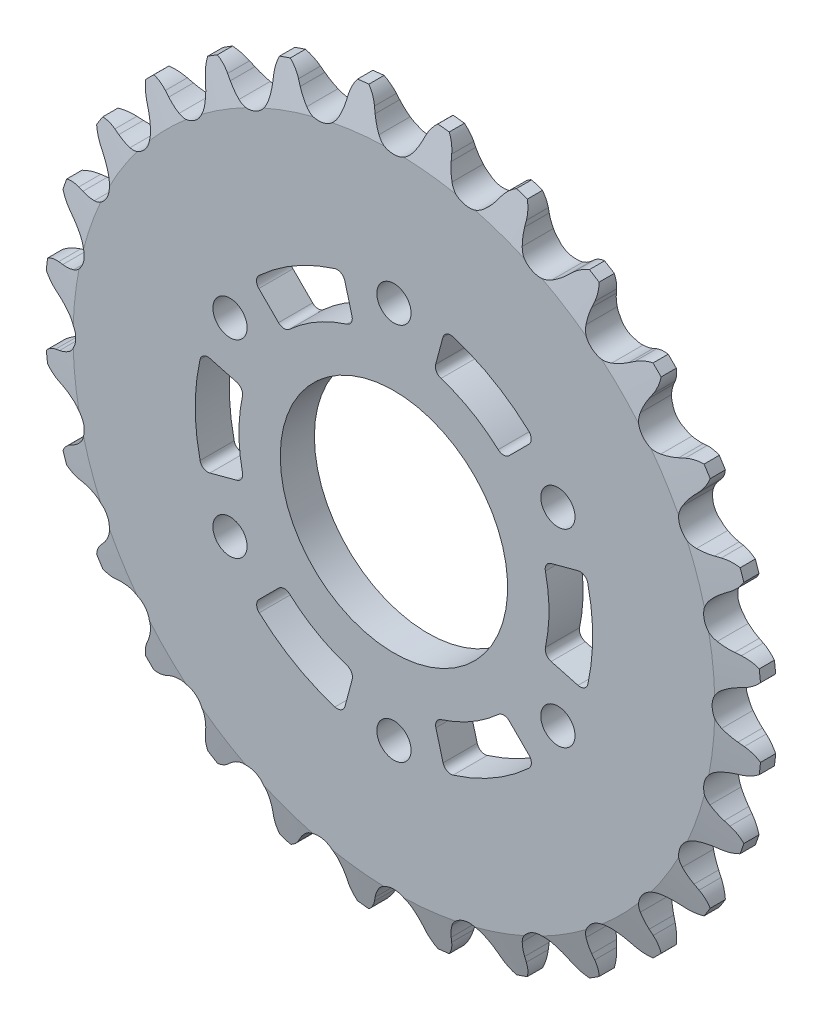
from build123d import *

# Parameters (mm, degrees)
CUT_EXTRUDE1_START    = -4.2926
CUT_EXTRUDE1_DEPTH    = 4.2926
CUT_EXTRUDE2_DEPTH    = 64.666804555
CUT_EXTRUDE3_DEPTH    = 64.666804555
CUT_EXTRUDE4_DEPTH    = 64.666804555
CUT_EXTRUDE5_DEPTH    = 64.666804555
CUT_EXTRUDE6_DEPTH    = 64.666804555
M25_CLEARANCE_HOLE1_D = 28.6
M4_CLEARANCE_HOLE1_D  = 4.3053
FILLET1_R             = 1


with BuildPart() as part:
    # Cut-Extrude1: read off the stored shape, not the designer's step
    # Cut-Extrude1 outline → Cut-Extrude1 (new body)
    with BuildSketch(Plane.XY.offset(2.146299997).offset(CUT_EXTRUDE1_START)):
        with BuildLine():
            ThreePointArc((39.558972766, 11.147399034), (40.203915636, 11.815256835), (40.935529884, 12.386856293))
            Line((40.935529884, 12.386856293), (41.504455801, 12.770601445))
            ThreePointArc((41.504455801, 12.770601445), (42.252526822, 13.418109876), (42.825156847, 14.224938406))
            ThreePointArc((42.825156847, 14.224938406), (42.593543808, 14.904125519), (42.351159936, 15.579543755))
            ThreePointArc((42.351159936, 15.579543755), (41.400410927, 15.853318653), (40.411831086, 15.89314666))
            Line((40.411831086, 15.89314666), (39.727762797, 15.838451055))
            ThreePointArc((39.727762797, 15.838451055), (38.799378208, 15.82919168), (37.878739938, 15.94922858))
            ThreePointArc((37.878739938, 15.94922858), (36.057866822, 17.36455347), (36.086617083, 19.670610032))
            ThreePointArc((36.086617083, 19.670610032), (36.566777547, 20.465236534), (37.152855853, 21.185304286))
            Line((37.152855853, 21.185304286), (37.62212628, 21.686026073))
            ThreePointArc((37.62212628, 21.686026073), (38.207357418, 22.483761578), (38.586094174, 23.3977834))
            ThreePointArc((38.586094174, 23.3977834), (38.209154806, 24.008403124), (37.822553308, 24.612951729))
            ThreePointArc((37.822553308, 24.612951729), (36.834720916, 24.668300961), (35.86206427, 24.487150687))
            Line((35.86206427, 24.487150687), (35.207317918, 24.281606901))
            ThreePointArc((35.207317918, 24.281606901), (34.304270273, 24.065994672), (33.380003604, 23.978160708))
            ThreePointArc((33.380003604, 23.978160708), (31.289844163, 24.952818062), (30.804727735, 27.207454507))
            ThreePointArc((30.804727735, 27.207454507), (31.096028541, 28.089003818), (31.507182493, 28.92143266))
            Line((31.507182493, 28.92143266), (31.85326625, 29.5140228))
            ThreePointArc((31.85326625, 29.5140228), (32.246311572, 30.42198359), (32.412163617, 31.397365833))
            ThreePointArc((32.412163617, 31.397365833), (31.908799236, 31.908799146), (31.397365924, 32.412163529))
            ThreePointArc((31.397365924, 32.412163529), (30.42198419, 32.246311653), (29.514023805, 31.85326673))
            Line((29.514023805, 31.85326673), (28.921431106, 31.507181585))
            ThreePointArc((28.921431106, 31.507181585), (28.089002986, 31.0960282), (27.207454507, 30.804727735))
            ThreePointArc((27.207454507, 30.804727735), (24.952818062, 31.289844163), (23.978160708, 33.380003604))
            ThreePointArc((23.978160708, 33.380003604), (24.06599482, 34.304271161), (24.28160744, 35.207319635))
            Line((24.28160744, 35.207319635), (24.487150443, 35.862063184))
            ThreePointArc((24.487150443, 35.862063184), (24.668301016, 36.834720313), (24.612951836, 37.822553239))
            ThreePointArc((24.612951836, 37.822553239), (24.008403232, 38.209154739), (23.397783508, 38.586094108))
            ThreePointArc((23.397783508, 38.586094108), (22.483762145, 38.207357631), (21.686026946, 37.622126971))
            Line((21.686026946, 37.622126971), (21.185302973, 37.152854623))
            ThreePointArc((21.185302973, 37.152854623), (20.465235799, 36.566777029), (19.670610032, 36.086617083))
            ThreePointArc((19.670610032, 36.086617083), (17.36455347, 36.057866822), (15.94922858, 37.878739938))
            ThreePointArc((15.94922858, 37.878739938), (15.829191627, 38.799379106), (15.838451198, 39.727764591))
            Line((15.838451198, 39.727764591), (15.893146664, 40.411829973))
            ThreePointArc((15.893146664, 40.411829973), (15.85331884, 41.400410352), (15.579543875, 42.351159893))
            ThreePointArc((15.579543875, 42.351159893), (14.90412564, 42.593543766), (14.224938527, 42.825156806))
            ThreePointArc((14.224938527, 42.825156806), (13.418110382, 42.252527156), (12.770602143, 41.504456669))
            Line((12.770602143, 41.504456669), (12.386855286, 40.935528393))
            ThreePointArc((12.386855286, 40.935528393), (11.815256233, 40.203914967), (11.147399034, 39.558972766))
            ThreePointArc((11.147399034, 39.558972766), (8.905557659, 39.017797475), (7.120535532, 40.478078083))
            ThreePointArc((7.120535532, 40.478078083), (6.798646668, 41.34892417), (6.601088878, 42.256093541))
            Line((6.601088878, 42.256093541), (6.502194146, 42.935178862))
            ThreePointArc((6.502194146, 42.935178862), (6.24338506, 43.890110942), (5.764912529, 44.756102546))
            ThreePointArc((5.764912529, 44.756102546), (5.052492953, 44.842114653), (4.338795729, 44.916787321))
            ThreePointArc((4.338795729, 44.916787321), (3.679618535, 44.178978539), (3.214806023, 43.305579603))
            Line((3.214806023, 43.305579603), (2.967278953, 42.665523837))
            ThreePointArc((2.967278953, 42.665523837), (2.572810384, 41.825060733), (2.0652109, 41.047676371))
            ThreePointArc((2.0652109, 41.047676371), (0, 40.021212838), (-2.0652109, 41.047676371))
            ThreePointArc((-2.0652109, 41.047676371), (-2.572810822, 41.825061518), (-2.967279602, 42.665525515))
            Line((-2.967279602, 42.665525515), (-3.214805536, 43.305578601))
            ThreePointArc((-3.214805536, 43.305578601), (-3.679618117, 44.178978101), (-4.338795603, 44.916787333))
            ThreePointArc((-4.338795603, 44.916787333), (-5.052492827, 44.842114667), (-5.764912403, 44.756102562))
            ThreePointArc((-5.764912403, 44.756102562), (-6.24338475, 43.890111462), (-6.502193895, 42.935179947))
            Line((-6.502193895, 42.935179947), (-6.601089137, 42.25609176))
            ThreePointArc((-6.601089137, 42.25609176), (-6.798646921, 41.348923306), (-7.120535532, 40.478078083))
            ThreePointArc((-7.120535532, 40.478078083), (-8.905557659, 39.017797475), (-11.147399034, 39.558972766))
            ThreePointArc((-11.147399034, 39.558972766), (-11.815256835, 40.203915636), (-12.386856293, 40.935529884))
            Line((-12.386856293, 40.935529884), (-12.770601445, 41.504455801))
            ThreePointArc((-12.770601445, 41.504455801), (-13.418109876, 42.252526822), (-14.224938406, 42.825156847))
            ThreePointArc((-14.224938406, 42.825156847), (-14.904125519, 42.593543808), (-15.579543755, 42.351159936))
            ThreePointArc((-15.579543755, 42.351159936), (-15.853318653, 41.400410927), (-15.89314666, 40.411831086))
            Line((-15.89314666, 40.411831086), (-15.838451055, 39.727762797))
            ThreePointArc((-15.838451055, 39.727762797), (-15.82919168, 38.799378208), (-15.94922858, 37.878739938))
            ThreePointArc((-15.94922858, 37.878739938), (-17.36455347, 36.057866822), (-19.670610032, 36.086617083))
            ThreePointArc((-19.670610032, 36.086617083), (-20.465236534, 36.566777547), (-21.185304286, 37.152855853))
            Line((-21.185304286, 37.152855853), (-21.686026073, 37.62212628))
            ThreePointArc((-21.686026073, 37.62212628), (-22.483761578, 38.207357418), (-23.3977834, 38.586094174))
            ThreePointArc((-23.3977834, 38.586094174), (-24.008403124, 38.209154806), (-24.612951729, 37.822553308))
            ThreePointArc((-24.612951729, 37.822553308), (-24.668300961, 36.834720916), (-24.487150687, 35.86206427))
            Line((-24.487150687, 35.86206427), (-24.281606901, 35.207317918))
            ThreePointArc((-24.281606901, 35.207317918), (-24.065994672, 34.304270273), (-23.978160708, 33.380003604))
            ThreePointArc((-23.978160708, 33.380003604), (-24.952818062, 31.289844163), (-27.207454507, 30.804727735))
            ThreePointArc((-27.207454507, 30.804727735), (-28.089003818, 31.096028541), (-28.92143266, 31.507182493))
            Line((-28.92143266, 31.507182493), (-29.5140228, 31.85326625))
            ThreePointArc((-29.5140228, 31.85326625), (-30.42198359, 32.246311572), (-31.397365833, 32.412163617))
            ThreePointArc((-31.397365833, 32.412163617), (-31.908799146, 31.908799236), (-32.412163529, 31.397365924))
            ThreePointArc((-32.412163529, 31.397365924), (-32.246311653, 30.42198419), (-31.85326673, 29.514023805))
            Line((-31.85326673, 29.514023805), (-31.507181585, 28.921431106))
            ThreePointArc((-31.507181585, 28.921431106), (-31.0960282, 28.089002986), (-30.804727735, 27.207454507))
            ThreePointArc((-30.804727735, 27.207454507), (-31.289844163, 24.952818062), (-33.380003604, 23.978160708))
            ThreePointArc((-33.380003604, 23.978160708), (-34.304271161, 24.06599482), (-35.207319635, 24.28160744))
            Line((-35.207319635, 24.28160744), (-35.862063184, 24.487150443))
            ThreePointArc((-35.862063184, 24.487150443), (-36.834720313, 24.668301016), (-37.822553239, 24.612951836))
            ThreePointArc((-37.822553239, 24.612951836), (-38.209154739, 24.008403232), (-38.586094108, 23.397783508))
            ThreePointArc((-38.586094108, 23.397783508), (-38.207357631, 22.483762145), (-37.622126971, 21.686026946))
            Line((-37.622126971, 21.686026946), (-37.152854623, 21.185302973))
            ThreePointArc((-37.152854623, 21.185302973), (-36.566777029, 20.465235799), (-36.086617083, 19.670610032))
            ThreePointArc((-36.086617083, 19.670610032), (-36.057866822, 17.36455347), (-37.878739938, 15.94922858))
            ThreePointArc((-37.878739938, 15.94922858), (-38.799379106, 15.829191627), (-39.727764591, 15.838451198))
            Line((-39.727764591, 15.838451198), (-40.411829973, 15.893146664))
            ThreePointArc((-40.411829973, 15.893146664), (-41.400410352, 15.85331884), (-42.351159893, 15.579543875))
            ThreePointArc((-42.351159893, 15.579543875), (-42.593543766, 14.90412564), (-42.825156806, 14.224938527))
            ThreePointArc((-42.825156806, 14.224938527), (-42.252527156, 13.418110382), (-41.504456669, 12.770602143))
            Line((-41.504456669, 12.770602143), (-40.935528393, 12.386855286))
            ThreePointArc((-40.935528393, 12.386855286), (-40.203914967, 11.815256233), (-39.558972766, 11.147399034))
            ThreePointArc((-39.558972766, 11.147399034), (-39.017797475, 8.905557659), (-40.478078083, 7.120535532))
            ThreePointArc((-40.478078083, 7.120535532), (-41.34892417, 6.798646668), (-42.256093541, 6.601088878))
            Line((-42.256093541, 6.601088878), (-42.935178862, 6.502194146))
            ThreePointArc((-42.935178862, 6.502194146), (-43.890110942, 6.24338506), (-44.756102546, 5.764912529))
            ThreePointArc((-44.756102546, 5.764912529), (-44.842114653, 5.052492953), (-44.916787321, 4.338795729))
            ThreePointArc((-44.916787321, 4.338795729), (-44.178978539, 3.679618535), (-43.305579603, 3.214806023))
            Line((-43.305579603, 3.214806023), (-42.665523837, 2.967278953))
            ThreePointArc((-42.665523837, 2.967278953), (-41.825060733, 2.572810384), (-41.047676371, 2.0652109))
            ThreePointArc((-41.047676371, 2.0652109), (-40.021212838, 0), (-41.047676371, -2.0652109))
            ThreePointArc((-41.047676371, -2.0652109), (-41.825061518, -2.572810822), (-42.665525515, -2.967279602))
            Line((-42.665525515, -2.967279602), (-43.305578601, -3.214805536))
            ThreePointArc((-43.305578601, -3.214805536), (-44.178978101, -3.679618117), (-44.916787333, -4.338795603))
            ThreePointArc((-44.916787333, -4.338795603), (-44.842114667, -5.052492827), (-44.756102562, -5.764912403))
            ThreePointArc((-44.756102562, -5.764912403), (-43.890111462, -6.24338475), (-42.935179947, -6.502193895))
            Line((-42.935179947, -6.502193895), (-42.25609176, -6.601089137))
            ThreePointArc((-42.25609176, -6.601089137), (-41.348923306, -6.798646921), (-40.478078083, -7.120535532))
            ThreePointArc((-40.478078083, -7.120535532), (-39.017797475, -8.905557659), (-39.558972766, -11.147399034))
            ThreePointArc((-39.558972766, -11.147399034), (-40.203915636, -11.815256835), (-40.935529884, -12.386856293))
            Line((-40.935529884, -12.386856293), (-41.504455801, -12.770601445))
            ThreePointArc((-41.504455801, -12.770601445), (-42.252526822, -13.418109876), (-42.825156847, -14.224938406))
            ThreePointArc((-42.825156847, -14.224938406), (-42.593543808, -14.904125519), (-42.351159936, -15.579543755))
            ThreePointArc((-42.351159936, -15.579543755), (-41.400410927, -15.853318653), (-40.411831086, -15.89314666))
            Line((-40.411831086, -15.89314666), (-39.727762797, -15.838451055))
            ThreePointArc((-39.727762797, -15.838451055), (-38.799378208, -15.82919168), (-37.878739938, -15.94922858))
            ThreePointArc((-37.878739938, -15.94922858), (-36.057866822, -17.36455347), (-36.086617083, -19.670610032))
            ThreePointArc((-36.086617083, -19.670610032), (-36.566777547, -20.465236534), (-37.152855853, -21.185304286))
            Line((-37.152855853, -21.185304286), (-37.62212628, -21.686026073))
            ThreePointArc((-37.62212628, -21.686026073), (-38.207357418, -22.483761578), (-38.586094174, -23.3977834))
            ThreePointArc((-38.586094174, -23.3977834), (-38.209154806, -24.008403124), (-37.822553308, -24.612951729))
            ThreePointArc((-37.822553308, -24.612951729), (-36.834720916, -24.668300961), (-35.86206427, -24.487150687))
            Line((-35.86206427, -24.487150687), (-35.207317918, -24.281606901))
            ThreePointArc((-35.207317918, -24.281606901), (-34.304270273, -24.065994672), (-33.380003604, -23.978160708))
            ThreePointArc((-33.380003604, -23.978160708), (-31.289844163, -24.952818062), (-30.804727735, -27.207454507))
            ThreePointArc((-30.804727735, -27.207454507), (-31.096028541, -28.089003818), (-31.507182493, -28.92143266))
            Line((-31.507182493, -28.92143266), (-31.85326625, -29.5140228))
            ThreePointArc((-31.85326625, -29.5140228), (-32.246311572, -30.42198359), (-32.412163617, -31.397365833))
            ThreePointArc((-32.412163617, -31.397365833), (-31.908799236, -31.908799146), (-31.397365924, -32.412163529))
            ThreePointArc((-31.397365924, -32.412163529), (-30.42198419, -32.246311653), (-29.514023805, -31.85326673))
            Line((-29.514023805, -31.85326673), (-28.921431106, -31.507181585))
            ThreePointArc((-28.921431106, -31.507181585), (-28.089002986, -31.0960282), (-27.207454507, -30.804727735))
            ThreePointArc((-27.207454507, -30.804727735), (-24.952818062, -31.289844163), (-23.978160708, -33.380003604))
            ThreePointArc((-23.978160708, -33.380003604), (-24.06599482, -34.304271161), (-24.28160744, -35.207319635))
            Line((-24.28160744, -35.207319635), (-24.487150443, -35.862063184))
            ThreePointArc((-24.487150443, -35.862063184), (-24.668301016, -36.834720313), (-24.612951836, -37.822553239))
            ThreePointArc((-24.612951836, -37.822553239), (-24.008403232, -38.209154739), (-23.397783508, -38.586094108))
            ThreePointArc((-23.397783508, -38.586094108), (-22.483762145, -38.207357631), (-21.686026946, -37.622126971))
            Line((-21.686026946, -37.622126971), (-21.185302973, -37.152854623))
            ThreePointArc((-21.185302973, -37.152854623), (-20.465235799, -36.566777029), (-19.670610032, -36.086617083))
            ThreePointArc((-19.670610032, -36.086617083), (-17.36455347, -36.057866822), (-15.94922858, -37.878739938))
            ThreePointArc((-15.94922858, -37.878739938), (-15.829191627, -38.799379106), (-15.838451198, -39.727764591))
            Line((-15.838451198, -39.727764591), (-15.893146664, -40.411829973))
            ThreePointArc((-15.893146664, -40.411829973), (-15.85331884, -41.400410352), (-15.579543875, -42.351159893))
            ThreePointArc((-15.579543875, -42.351159893), (-14.90412564, -42.593543766), (-14.224938527, -42.825156806))
            ThreePointArc((-14.224938527, -42.825156806), (-13.418110382, -42.252527156), (-12.770602143, -41.504456669))
            Line((-12.770602143, -41.504456669), (-12.386855286, -40.935528393))
            ThreePointArc((-12.386855286, -40.935528393), (-11.815256233, -40.203914967), (-11.147399034, -39.558972766))
            ThreePointArc((-11.147399034, -39.558972766), (-8.905557659, -39.017797475), (-7.120535532, -40.478078083))
            ThreePointArc((-7.120535532, -40.478078083), (-6.798646668, -41.34892417), (-6.601088878, -42.256093541))
            Line((-6.601088878, -42.256093541), (-6.502194146, -42.935178862))
            ThreePointArc((-6.502194146, -42.935178862), (-6.24338506, -43.890110942), (-5.764912529, -44.756102546))
            ThreePointArc((-5.764912529, -44.756102546), (-5.052492953, -44.842114653), (-4.338795729, -44.916787321))
            ThreePointArc((-4.338795729, -44.916787321), (-3.679618535, -44.178978539), (-3.214806023, -43.305579603))
            Line((-3.214806023, -43.305579603), (-2.967278953, -42.665523837))
            ThreePointArc((-2.967278953, -42.665523837), (-2.572810384, -41.825060733), (-2.0652109, -41.047676371))
            ThreePointArc((-2.0652109, -41.047676371), (0, -40.021212838), (2.0652109, -41.047676371))
            ThreePointArc((2.0652109, -41.047676371), (2.572810822, -41.825061518), (2.967279602, -42.665525515))
            Line((2.967279602, -42.665525515), (3.214805536, -43.305578601))
            ThreePointArc((3.214805536, -43.305578601), (3.679618117, -44.178978101), (4.338795603, -44.916787333))
            ThreePointArc((4.338795603, -44.916787333), (5.052492827, -44.842114667), (5.764912403, -44.756102562))
            ThreePointArc((5.764912403, -44.756102562), (6.24338475, -43.890111462), (6.502193895, -42.935179947))
            Line((6.502193895, -42.935179947), (6.601089137, -42.25609176))
            ThreePointArc((6.601089137, -42.25609176), (6.798646921, -41.348923306), (7.120535532, -40.478078083))
            ThreePointArc((7.120535532, -40.478078083), (8.905557659, -39.017797475), (11.147399034, -39.558972766))
            ThreePointArc((11.147399034, -39.558972766), (11.815256835, -40.203915636), (12.386856293, -40.935529884))
            Line((12.386856293, -40.935529884), (12.770601445, -41.504455801))
            ThreePointArc((12.770601445, -41.504455801), (13.418109876, -42.252526822), (14.224938406, -42.825156847))
            ThreePointArc((14.224938406, -42.825156847), (14.904125519, -42.593543808), (15.579543755, -42.351159936))
            ThreePointArc((15.579543755, -42.351159936), (15.853318653, -41.400410927), (15.89314666, -40.411831086))
            Line((15.89314666, -40.411831086), (15.838451055, -39.727762797))
            ThreePointArc((15.838451055, -39.727762797), (15.82919168, -38.799378208), (15.94922858, -37.878739938))
            ThreePointArc((15.94922858, -37.878739938), (17.36455347, -36.057866822), (19.670610032, -36.086617083))
            ThreePointArc((19.670610032, -36.086617083), (20.465236534, -36.566777547), (21.185304286, -37.152855853))
            Line((21.185304286, -37.152855853), (21.686026073, -37.62212628))
            ThreePointArc((21.686026073, -37.62212628), (22.483761578, -38.207357418), (23.3977834, -38.586094174))
            ThreePointArc((23.3977834, -38.586094174), (24.008403124, -38.209154806), (24.612951729, -37.822553308))
            ThreePointArc((24.612951729, -37.822553308), (24.668300961, -36.834720916), (24.487150687, -35.86206427))
            Line((24.487150687, -35.86206427), (24.281606901, -35.207317918))
            ThreePointArc((24.281606901, -35.207317918), (24.065994672, -34.304270273), (23.978160708, -33.380003604))
            ThreePointArc((23.978160708, -33.380003604), (24.952818062, -31.289844163), (27.207454507, -30.804727735))
            ThreePointArc((27.207454507, -30.804727735), (28.089003818, -31.096028541), (28.92143266, -31.507182493))
            Line((28.92143266, -31.507182493), (29.5140228, -31.85326625))
            ThreePointArc((29.5140228, -31.85326625), (30.42198359, -32.246311572), (31.397365833, -32.412163617))
            ThreePointArc((31.397365833, -32.412163617), (31.908799146, -31.908799236), (32.412163529, -31.397365924))
            ThreePointArc((32.412163529, -31.397365924), (32.246311653, -30.42198419), (31.85326673, -29.514023805))
            Line((31.85326673, -29.514023805), (31.507181585, -28.921431106))
            ThreePointArc((31.507181585, -28.921431106), (31.0960282, -28.089002986), (30.804727735, -27.207454507))
            ThreePointArc((30.804727735, -27.207454507), (31.289844163, -24.952818062), (33.380003604, -23.978160708))
            ThreePointArc((33.380003604, -23.978160708), (34.304271161, -24.06599482), (35.207319635, -24.28160744))
            Line((35.207319635, -24.28160744), (35.862063184, -24.487150443))
            ThreePointArc((35.862063184, -24.487150443), (36.834720313, -24.668301016), (37.822553239, -24.612951836))
            ThreePointArc((37.822553239, -24.612951836), (38.209154739, -24.008403232), (38.586094108, -23.397783508))
            ThreePointArc((38.586094108, -23.397783508), (38.207357631, -22.483762145), (37.622126971, -21.686026946))
            Line((37.622126971, -21.686026946), (37.152854623, -21.185302973))
            ThreePointArc((37.152854623, -21.185302973), (36.566777029, -20.465235799), (36.086617083, -19.670610032))
            ThreePointArc((36.086617083, -19.670610032), (36.057866822, -17.36455347), (37.878739938, -15.94922858))
            ThreePointArc((37.878739938, -15.94922858), (38.799379106, -15.829191627), (39.727764591, -15.838451198))
            Line((39.727764591, -15.838451198), (40.411829973, -15.893146664))
            ThreePointArc((40.411829973, -15.893146664), (41.400410352, -15.85331884), (42.351159893, -15.579543875))
            ThreePointArc((42.351159893, -15.579543875), (42.593543766, -14.90412564), (42.825156806, -14.224938527))
            ThreePointArc((42.825156806, -14.224938527), (42.252527156, -13.418110382), (41.504456669, -12.770602143))
            Line((41.504456669, -12.770602143), (40.935528393, -12.386855286))
            ThreePointArc((40.935528393, -12.386855286), (40.203914967, -11.815256233), (39.558972766, -11.147399034))
            ThreePointArc((39.558972766, -11.147399034), (39.017797475, -8.905557659), (40.478078083, -7.120535532))
            ThreePointArc((40.478078083, -7.120535532), (41.34892417, -6.798646668), (42.256093541, -6.601088878))
            Line((42.256093541, -6.601088878), (42.935178862, -6.502194146))
            ThreePointArc((42.935178862, -6.502194146), (43.890110942, -6.24338506), (44.756102546, -5.764912529))
            ThreePointArc((44.756102546, -5.764912529), (44.842114653, -5.052492953), (44.916787321, -4.338795729))
            ThreePointArc((44.916787321, -4.338795729), (44.178978539, -3.679618535), (43.305579603, -3.214806023))
            Line((43.305579603, -3.214806023), (42.665523837, -2.967278953))
            ThreePointArc((42.665523837, -2.967278953), (41.825060733, -2.572810384), (41.047676371, -2.0652109))
            ThreePointArc((41.047676371, -2.0652109), (40.021212838, 0), (41.047676371, 2.0652109))
            ThreePointArc((41.047676371, 2.0652109), (41.825061518, 2.572810822), (42.665525515, 2.967279602))
            Line((42.665525515, 2.967279602), (43.305577406, 3.214805074))
            ThreePointArc((43.305577406, 3.214805074), (44.178977575, 3.67961775), (44.916787333, 4.338795603))
            ThreePointArc((44.916787333, 4.338795603), (44.842114667, 5.052492827), (44.756102562, 5.764912403))
            ThreePointArc((44.756102562, 5.764912403), (43.890111462, 6.24338475), (42.935179947, 6.502193895))
            Line((42.935179947, 6.502193895), (42.25609176, 6.601089137))
            ThreePointArc((42.25609176, 6.601089137), (41.348923306, 6.798646921), (40.478078083, 7.120535532))
            ThreePointArc((40.478078083, 7.120535532), (39.017797475, 8.905557659), (39.558972766, 11.147399034))
        make_face()
        with BuildLine():
            ThreePointArc((-17.713554058, 17.641712009), (-12.510996923, 21.644282294), (-6.445938272, 24.154707197))
            Line((-6.445938272, 24.154707197), (-5.022432582, 18.842111637))
            ThreePointArc((-5.022432582, 18.842111637), (-9.760996476, 16.88114178), (-13.824456468, 13.752614419))
            Line((-13.824456468, 13.752614419), (-17.713554058, 17.641712009))
        make_face(mode=Mode.SUBTRACT)
    extrude(amount=CUT_EXTRUDE1_DEPTH)

    # Cut-Extrude1 2 outline → Cut-Extrude1 2 (revolve, cut)
    with BuildSketch(Plane.XZ):
        Polygon((45.125856575, 2.1463), (40.363356562, 2.1463), (45.125856575, 0.955674997), align=None)
        Polygon((45.125856575, -2.146300003), (45.125856575, -0.955675003), (40.363356575, -2.146300003), align=None)
    revolve(axis=Axis((0, 0, 0), (0, 0, 1)), mode=Mode.SUBTRACT)

    # Sketch2 → Cut-Extrude2 (cut, through all)
    with BuildSketch(Plane.XY.offset(2.146299997)):
        with BuildLine():
            Line((-6.421393737, -24.161243811), (-4.997885221, -18.848637704))
            ThreePointArc((-4.997885221, -18.848637704), (-9.738999389, -16.893841804), (-13.806531048, -13.770610024))
            Line((-13.806531048, -13.770610024), (-17.695620918, -17.659699893))
            ThreePointArc((-17.695620918, -17.659699893), (-12.488999852, -21.656982308), (-6.421393737, -24.161243811))
        make_face()
    extrude(amount=-CUT_EXTRUDE2_DEPTH, mode=Mode.SUBTRACT)

    # Sketch3 → Cut-Extrude3 (cut, through all)
    with BuildSketch(Plane.XY.offset(2.146299997)):
        with BuildLine():
            Line((17.713554058, -17.641712009), (13.824456468, -13.752614419))
            ThreePointArc((13.824456468, -13.752614419), (9.760996476, -16.88114178), (5.022432582, -18.842111637))
            Line((5.022432582, -18.842111637), (6.445938272, -24.154707197))
            ThreePointArc((6.445938272, -24.154707197), (12.510996922, -21.644282294), (17.713554058, -17.641712009))
        make_face()
    extrude(amount=-CUT_EXTRUDE3_DEPTH, mode=Mode.SUBTRACT)

    # Sketch4 → Cut-Extrude4 (cut, through all)
    with BuildSketch(Plane.XY.offset(2.146299997)):
        with BuildLine():
            Line((24.134947796, 6.519531801), (18.822341689, 5.096023285))
            ThreePointArc((18.822341689, 5.096023285), (19.499995864, 0.012700024), (18.82896363, -5.071501614))
            Line((18.82896363, -5.071501614), (24.14155919, -6.495007304))
            ThreePointArc((24.14155919, -6.495007304), (24.999996774, 0.012700015), (24.134947796, 6.519531801))
        make_face()
    extrude(amount=-CUT_EXTRUDE4_DEPTH, mode=Mode.SUBTRACT)

    # Sketch5 → Cut-Extrude5 (cut, through all)
    with BuildSketch(Plane.XY.offset(2.146299997)):
        with BuildLine():
            Line((6.421393737, 24.161243811), (4.997885221, 18.848637704))
            ThreePointArc((4.997885221, 18.848637704), (9.738999389, 16.893841804), (13.806531048, 13.770610024))
            Line((13.806531048, 13.770610024), (17.695620918, 17.659699893))
            ThreePointArc((17.695620918, 17.659699893), (12.488999852, 21.656982308), (6.421393737, 24.161243811))
        make_face()
    extrude(amount=-CUT_EXTRUDE5_DEPTH, mode=Mode.SUBTRACT)

    # Sketch6 → Cut-Extrude6 (cut, through all)
    with BuildSketch(Plane(origin=(0, 0, -2.146300003), x_dir=(-1, 0, 0), z_dir=(0, 0, -1))):
        with BuildLine():
            Line((24.14155919, 6.495007304), (18.82896363, 5.071501614))
            ThreePointArc((18.82896363, 5.071501614), (19.499995864, -0.012700024), (18.822341689, -5.096023285))
            Line((18.822341689, -5.096023285), (24.134947796, -6.519531801))
            ThreePointArc((24.134947796, -6.519531801), (24.999996774, -0.012700015), (24.14155919, 6.495007304))
        make_face()
    extrude(amount=-CUT_EXTRUDE6_DEPTH, mode=Mode.SUBTRACT)

    # M25 Clearance Hole1 (through all)
    with Locations(Plane(origin=(0, 0, -2.146300003), x_dir=(-1, 0, 0), z_dir=(0, 0, -1))):
        with Locations((0, 0)):
            Hole(M25_CLEARANCE_HOLE1_D / 2)

    # M4 Clearance Hole1 (through all)
    with Locations(Plane(origin=(0, 0, -2.146300003), x_dir=(-1, 0, 0), z_dir=(0, 0, -1))):
        with Locations((0, -23.8125), (20.622229928, -11.90625), (-20.622229928, 11.90625), (0, 23.8125), (20.622229928, 11.90625), (-20.622229928, -11.90625)):
            Hole(M4_CLEARANCE_HOLE1_D / 2)

    # Fillet1
    fillet1_edges = [part.edges().sort_by_distance(p)[0] for p in [
        (-17.713554058, 17.641712009, -3e-09),
        (-6.445938272, 24.154707197, -3e-09),
        (-5.022432582, 18.842111637, -3e-09),
        (-13.824456468, 13.752614419, -3e-09),
        (-6.421393737, -24.161243811, -3e-09),
        (-17.695620918, -17.659699893, -3e-09),
        (-13.806531048, -13.770610024, -3e-09),
        (-4.997885221, -18.848637704, -3e-09),
        (17.713554058, -17.641712009, -3e-09),
        (6.445938272, -24.154707197, -3e-09),
        (5.022432582, -18.842111637, -3e-09),
        (13.824456468, -13.752614419, -3e-09),
        (24.134947796, 6.519531801, -3e-09),
        (24.14155919, -6.495007304, -3e-09),
        (18.82896363, -5.071501614, -3e-09),
        (18.822341689, 5.096023285, -3e-09),
        (6.421393737, 24.161243811, -3e-09),
        (17.695620918, 17.659699893, -3e-09),
        (13.806531048, 13.770610024, -3e-09),
        (4.997885221, 18.848637704, -3e-09),
        (-24.14155919, 6.495007304, -3e-09),
        (-24.134947796, -6.519531801, -3e-09),
        (-18.822341689, -5.096023285, -3e-09),
        (-18.82896363, 5.071501614, -3e-09),
    ]]
    fillet(fillet1_edges, radius=FILLET1_R)


solid = part.part
